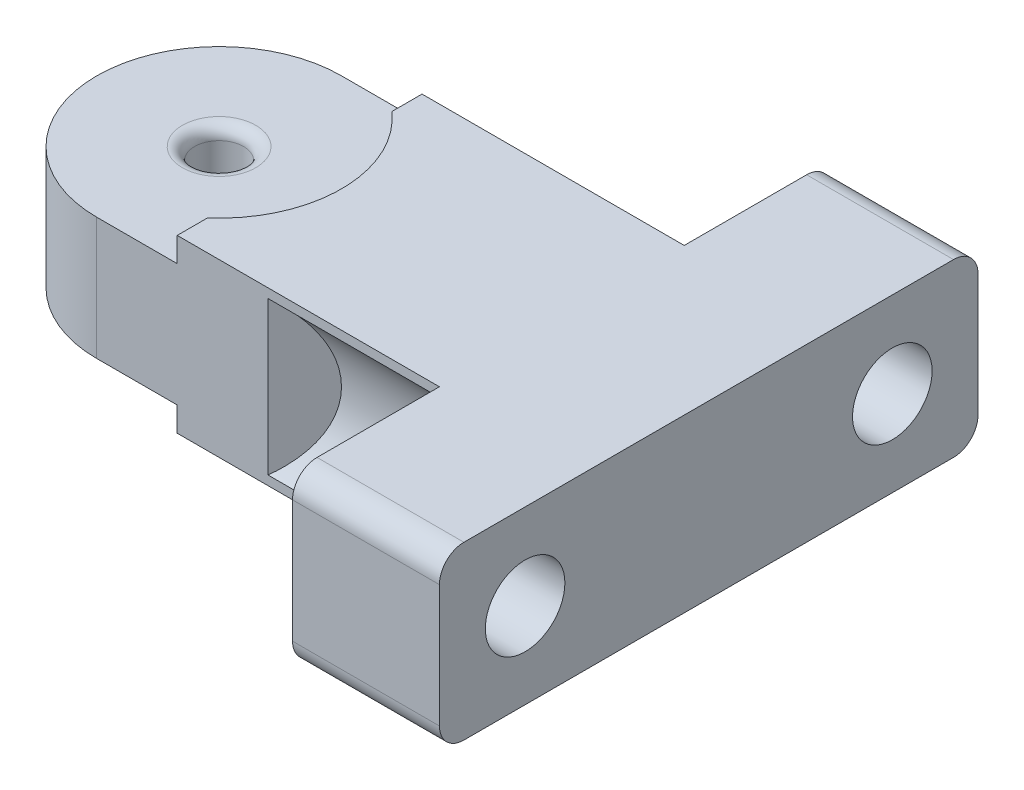
from build123d import *

# Parameters (mm, degrees)
SKETCH1_W           = 50
SKETCH1_H           = 20
BOSS_EXTRUDE1_DEPTH = 10
FILLET1_R           = 10
SKETCH2_R           = 2
CUT_EXTRUDE1_DEPTH  = 10
BOSS_EXTRUDE3_DEPTH = 2
FILLET4_R           = 1
SKETCH9_W           = 12
SKETCH9_H           = 14
BOSS_EXTRUDE4_DEPTH = 12
SKETCH10_R          = 3.25
CUT_EXTRUDE4_DEPTH  = 18
SKETCH13_R          = 8
CUT_EXTRUDE5_DEPTH  = 10
CHAMFER4_SIZE       = 4
FILLET6_R           = 2
BOSS_EXTRUDE5_DEPTH = 1


# Some blends are built 0.0001 mm under size
with BuildPart() as part:
    # Sketch1 → Boss-Extrude1 (new body)
    with BuildSketch(Plane(origin=(0, 0, 0), x_dir=(1, 0, 0), z_dir=(0, 1, 0))):
        Rectangle(SKETCH1_W, SKETCH1_H)
    extrude(amount=BOSS_EXTRUDE1_DEPTH)

    # Fillet1
    fillet1_edges = [part.edges().sort_by_distance(p)[0] for p in [
        (-25, 5, 10),
        (-25, 5, -10),
    ]]
    fillet(fillet1_edges, radius=FILLET1_R - 0.0001)  # a hair under: the kernel refuses the full size

    # Sketch2 → Cut-Extrude1 (cut)
    with BuildSketch(Plane(origin=(0, 10, 0), x_dir=(1, 0, 0), z_dir=(0, 1, 0))):
        with Locations(Location((-15, 0, 0), (0, 0, 270))):
            Circle(SKETCH2_R)
    extrude(amount=-CUT_EXTRUDE1_DEPTH, mode=Mode.SUBTRACT)

    # Sketch6 → Boss-Extrude3 (add)
    with BuildSketch(Plane(origin=(0, 10, 0), x_dir=(1, 0, 0), z_dir=(0, 1, 0))):
        with BuildLine():
            Line((-8.420233762, 10), (-8.420233762, 7.53038354))
            ThreePointArc((-8.420233762, 7.53038354), (-5, 0), (-8.420233762, -7.53038354))
            Line((-8.420233762, -7.53038354), (-8.420233762, -10))
            Line((-8.420233762, -10), (25, -10))
            Line((25, -10), (25, 10))
            Line((25, 10), (-8.420233762, 10))
        make_face()
    boss_extrude3 = extrude(amount=BOSS_EXTRUDE3_DEPTH)

    # Mirror3: Boss-Extrude3 across plane
    add(boss_extrude3.mirror(Plane(origin=(0, 5, 0), x_dir=(0, 0, 1), z_dir=(0, -1, 0))))

    # Fillet4
    fillet4_edges = [part.edges().sort_by_distance(p)[0] for p in [
        (-15, 0, -2),
        (-15, 10, -2),
    ]]
    fillet(fillet4_edges, radius=FILLET4_R)

    # Sketch9 → Boss-Extrude4 (add)
    with BuildSketch(Plane(origin=(25, 0, 0), x_dir=(0, 0, -1), z_dir=(1, 0, 0))):
        with Locations((-16, 5)):
            Rectangle(SKETCH9_W, SKETCH9_H)
        with Locations((16, 5)):
            Rectangle(SKETCH9_W, SKETCH9_H)
    extrude(amount=-BOSS_EXTRUDE4_DEPTH)

    # Sketch10 → Cut-Extrude4 (cut)
    with BuildSketch(Plane(origin=(25, 0, 0), x_dir=(0, 0, -1), z_dir=(1, 0, 0))):
        with Locations((-15, 5)):
            Circle(SKETCH10_R)
        with Locations((15, 5)):
            Circle(SKETCH10_R)
    extrude(amount=-CUT_EXTRUDE4_DEPTH, mode=Mode.SUBTRACT)

    # Sketch13 → Cut-Extrude5 (cut)
    with BuildSketch(Plane.ZY.offset(-13)):
        with Locations((15, 5)):
            Circle(SKETCH13_R)
    cut_extrude5 = extrude(amount=CUT_EXTRUDE5_DEPTH, mode=Mode.SUBTRACT)

    # Mirror7: Cut-Extrude5 across plane
    add(cut_extrude5.mirror(Plane.XY), mode=Mode.SUBTRACT)

    # Chamfer4
    # the kernel refuses this chamfer: 4 mm, written as the material it takes off along each edge
    with BuildSketch(Plane(origin=(3, 21.53172995, 10), x_dir=(-0.9996219169112968, 0, 0.027495876610586917), z_dir=(0, -1, 0))) as chamfer4_piece_1_section:
        Polygon((CHAMFER4_SIZE * 0.999621916911, CHAMFER4_SIZE * 0.0274958766106), (-CHAMFER4_SIZE * 0.0274958766106, CHAMFER4_SIZE * 0.999621916911), (0, 0), align=None)
    chamfer4_piece_1 = extrude(amount=33.063459901, mode=Mode.PRIVATE)
    chamfer4_piece_1 = chamfer4_piece_1 & Plane(origin=(1.498847972, 5, 15), x_dir=(0, 0, 1), z_dir=(1, 0, 0)) * Cylinder(8, 83, mode=Mode.PRIVATE)
    add(chamfer4_piece_1, mode=Mode.SUBTRACT)
    with BuildSketch(Plane(origin=(3, 21.53172995, -10), x_dir=(0.027495876610586382, 0, 0.9996219169112968), z_dir=(0, -1, 0))) as chamfer4_piece_2_section:
        Polygon((CHAMFER4_SIZE * 0.999621916911, CHAMFER4_SIZE * 0.0274958766106), (-CHAMFER4_SIZE * 0.0274958766106, CHAMFER4_SIZE * 0.999621916911), (0, 0), align=None)
    chamfer4_piece_2 = extrude(amount=33.063459901, mode=Mode.PRIVATE)
    chamfer4_piece_2 = chamfer4_piece_2 & Plane(origin=(1.498847972, 5, -15), x_dir=(0, 0, -1), z_dir=(1, 0, 0)) * Cylinder(8, 83, mode=Mode.PRIVATE)
    add(chamfer4_piece_2, mode=Mode.SUBTRACT)

    # Fillet6
    fillet6_edges = [part.edges().sort_by_distance(p)[0] for p in [
        (19, -2, 22),
        (19, 12, 22),
        (19, 12, -22),
        (19, -2, -22),
    ]]
    fillet(fillet6_edges, radius=FILLET6_R)

    # Sketch14 → Boss-Extrude5 (add)
    with BuildSketch(Plane.XZ):
        with BuildLine():
            ThreePointArc((-17.883785088, -0.826912067), (-17.970804206, -0.417519303), (-18, 0))
            Line((-18, 0), (-25, 0))
            ThreePointArc((-25, 0), (-24.902680687, -1.39173101), (-24.612616959, -2.756373558))
            Line((-24.612616959, -2.756373558), (-17.883785088, -0.826912067))
        make_face()
    extrude(amount=BOSS_EXTRUDE5_DEPTH)


solid = part.part
